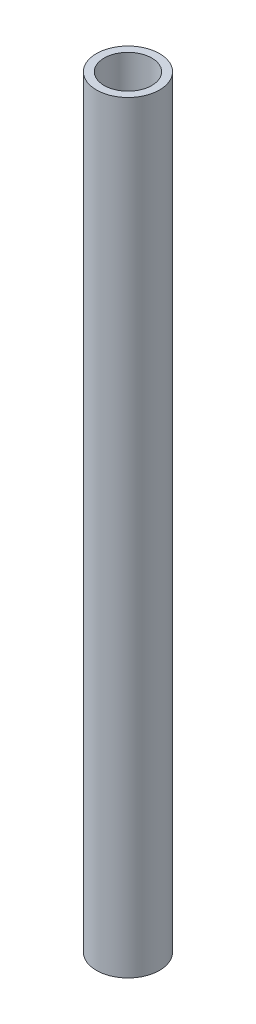
from build123d import *

# Parameters (mm, degrees)
SKETCH1_R           = 4.2037
SKETCH1_R_2         = 3.175
BOSS_EXTRUDE1_DEPTH = 101.6


with BuildPart() as part:
    # Sketch1 → Boss-Extrude1 (new body)
    with BuildSketch(Plane(origin=(0, 0, 0), x_dir=(1, 0, 0), z_dir=(0, 1, 0))):
        Circle(SKETCH1_R)
        Circle(SKETCH1_R_2, mode=Mode.SUBTRACT)
    extrude(amount=BOSS_EXTRUDE1_DEPTH)


solid = part.part
